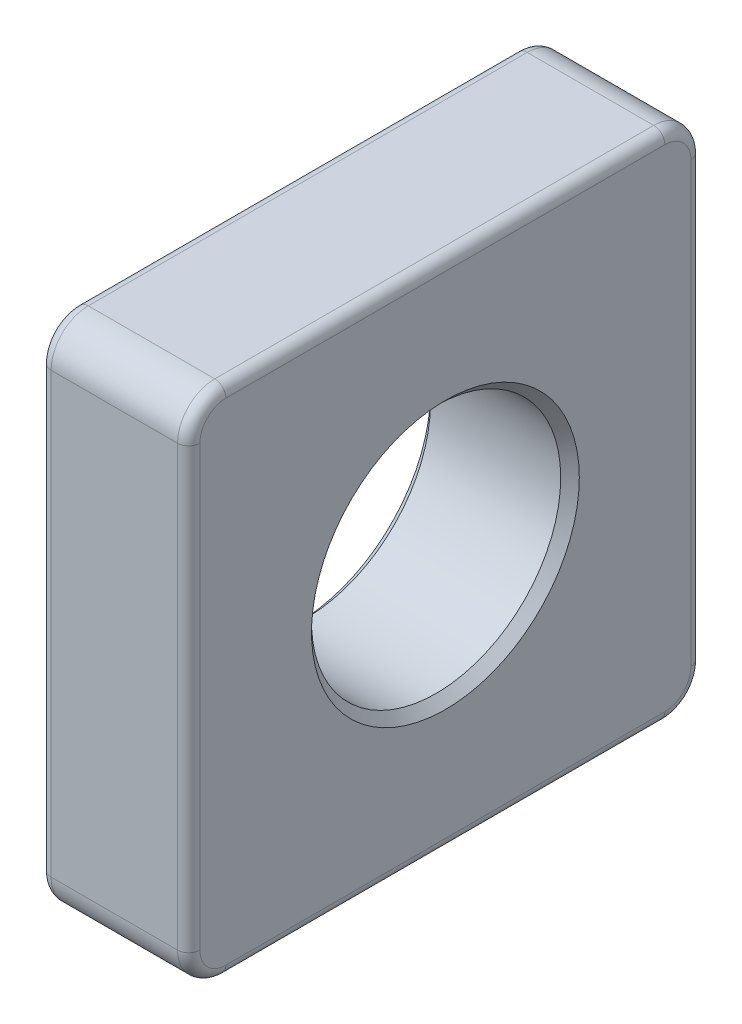
from build123d import *

# Parameters (mm, degrees)
SKETCH1_W           = 13.8
SKETCH1_H           = 13.8
BOSS_EXTRUDE1_DEPTH = 4
SKETCH2_R           = 3.35
CUT_EXTRUDE1_DEPTH  = 11.546089323
CHAMFER1_SIZE       = 0.25
FILLET1_R           = 1
FILLET2_R           = 0.3


with BuildPart() as part:
    # Sketch1 → Boss-Extrude1 (new body)
    with BuildSketch(Plane(origin=(0, 0, 0), x_dir=(0, 0, -1), z_dir=(1, 0, 0))):
        Rectangle(SKETCH1_W, SKETCH1_H)
    extrude(amount=BOSS_EXTRUDE1_DEPTH)

    # Sketch2 → Cut-Extrude1 (cut, through all)
    with BuildSketch(Plane(origin=(0, 0, 0), x_dir=(0, 0, -1), z_dir=(1, 0, 0))):
        Circle(SKETCH2_R)
    extrude(amount=CUT_EXTRUDE1_DEPTH, mode=Mode.SUBTRACT)

    # Chamfer1
    chamfer1_edges = [part.edges().sort_by_distance(p)[0] for p in [
        (0, 0, 3.35),
        (4, 0, 3.35),
    ]]
    chamfer(chamfer1_edges, length=CHAMFER1_SIZE)

    # Fillet1
    fillet1_edges = [part.edges().sort_by_distance(p)[0] for p in [
        (2, 6.9, -6.9),
        (2, -6.9, -6.9),
        (2, -6.9, 6.9),
        (2, 6.9, 6.9),
    ]]
    fillet(fillet1_edges, radius=FILLET1_R)

    # Fillet2
    fillet2_edges = [part.edges().sort_by_distance(p)[0] for p in [
        (0, 6.607106781, 6.607106781),
        (0, 6.9, 0),
        (0, 6.607106781, -6.607106781),
        (0, 0, -6.9),
        (0, -6.607106781, -6.607106781),
        (0, -6.9, 0),
        (0, -6.607106781, 6.607106781),
        (4, -6.607106781, 6.607106781),
        (4, 0, 6.9),
        (4, 6.607106781, 6.607106781),
        (4, 6.9, 0),
        (4, 6.607106781, -6.607106781),
        (4, 0, -6.9),
        (4, -6.607106781, -6.607106781),
        (0, 0, 6.9),
        (4, -6.9, 0),
    ]]
    fillet(fillet2_edges, radius=FILLET2_R)


solid = part.part
